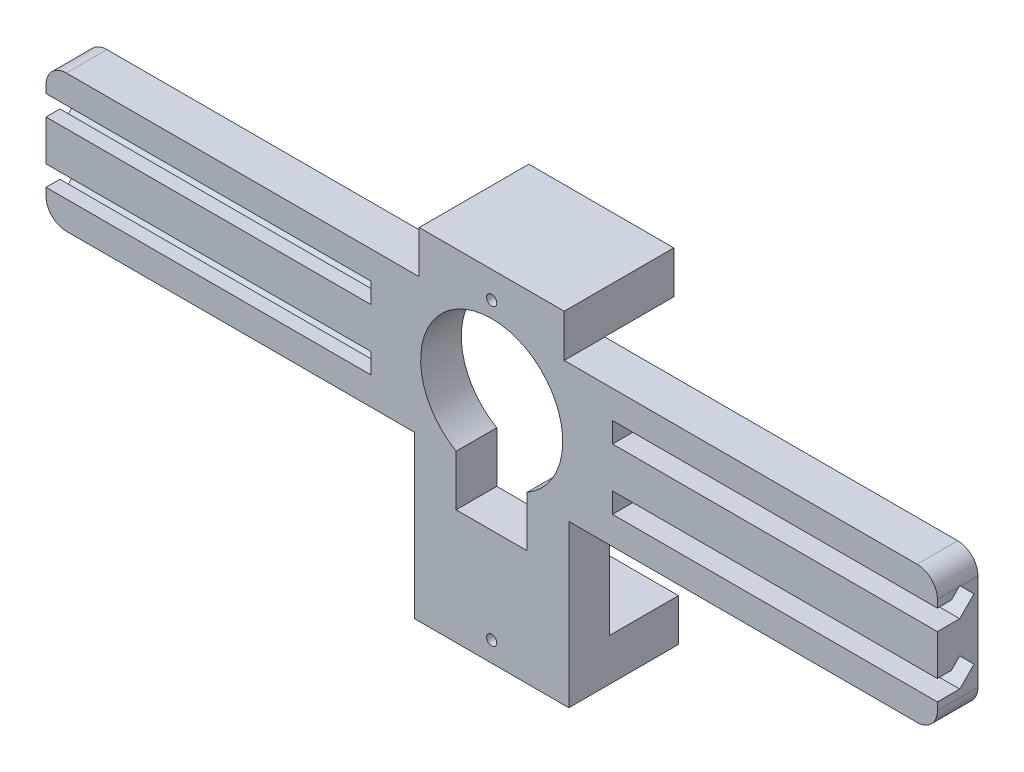
from build123d import *
from build123d.topology import SkipClean

# Parameters (mm, degrees)
SKETCH_1_R              = 0.5
EXTRUDE_1_DEPTH         = 4
CUT_EXTRUDE_1_DEPTH     = 32
FILLET_2_R              = 2
EXTRUDE_START           = 6.8
SKETCH_3_W              = 14.282856858
SKETCH_3_H              = 4.17
SKETCH_3_R              = 0.5
SKETCH_3_W_2            = 15.198684154
EXTRUDE_2_DEPTH         = 6.8
SALIENTE_EXTRUIR1_START = -32
SALIENTE_EXTRUIR1_DEPTH = 32
CORTAR_EXTRUIR1_DEPTH   = 32


with BuildPart() as part:
    # 草图1 → 凸台-拉伸1 (new body)
    with BuildSketch(Plane.XY):
        Polygon((7.141428429, 7), (43.9, 7), (43.9, -6.5), (7.599342077, -6.5), (7.599342077, -22.4), (-7.599342077, -22.4), (-7.599342077, -6.5), (-43.9, -6.5), (-43.9, 7), (-7.141428429, 7), (-7.141428429, 11.2), (7.141428429, 11.2), align=None)
        with Locations((0, 8.575)):
            Circle(SKETCH_1_R, mode=Mode.SUBTRACT)
        with Locations((0, -20.42)):
            Circle(SKETCH_1_R, mode=Mode.SUBTRACT)
        with BuildLine():
            Line((-3.5, -11.062177826), (3.5, -11.062177826))
            Line((3.5, -11.062177826), (3.5, -6.062177826))
            ThreePointArc((3.5, -6.062177826), (0, 7), (-3.5, -6.062177826))
            Line((-3.5, -6.062177826), (-3.5, -11.062177826))
        make_face(mode=Mode.SUBTRACT)
    extrude(amount=EXTRUDE_1_DEPTH)

    # 草图2 → 切除-拉伸1 (cut)
    with BuildSketch(Plane(origin=(43.9, 0, 0), x_dir=(0, 0, -1), z_dir=(1, 0, 0))):
        Polygon((-4, 2.25), (-1.8, 2.25), (-0.385786438, 3.664213562), (-1.8, 5.078427125), (-2.628427125, 4.25), (-4, 4.25), align=None)
        Polygon((-1.8, -3.75), (-0.385786438, -2.335786438), (-1.8, -0.921572875), (-2.628427125, -1.75), (-4, -1.75), (-4, -3.75), align=None)
    cut_extrude_1 = extrude(amount=-CUT_EXTRUDE_1_DEPTH, mode=Mode.SUBTRACT)

    # 镜向1: 切除-拉伸1 across plane
    add(cut_extrude_1.mirror(Plane(origin=(0, 0, 0), x_dir=(0, 0, 1), z_dir=(1, 0, 0))), mode=Mode.SUBTRACT)

    # 圆角2
    # the kernel refuses this fillet: 2 mm, written as the material it takes off along each edge
    with BuildSketch(Plane(origin=(43.9, 7, -5), x_dir=(-1, 0, 0), z_dir=(0, 0, 1)), Plane(origin=(43.9, -6.5, -5), x_dir=(0, 1, 0), z_dir=(0, 0, 1)), Plane(origin=(-43.9, -6.5, -5), x_dir=(1, 0, 0), z_dir=(0, 0, 1)), Plane(origin=(-43.9, 7, -5), x_dir=(0, -1, 0), z_dir=(0, 0, 1))) as fillet_2_piece_1:
        with BuildLine():
            CenterArc((FILLET_2_R, FILLET_2_R), FILLET_2_R, 180, 90)
            Line((0, FILLET_2_R), (0, 0))
            Line((0, 0), (FILLET_2_R, 0))
        make_face()
    extrude(amount=14, mode=Mode.SUBTRACT)

    # 草图3 → 凸台-拉伸2 (add)
    # profile 1 of 2: a face of its own
    with BuildSketch(Plane(origin=(0, 0, 0), x_dir=(-1, 0, 0), z_dir=(0, 0, -1)).offset(EXTRUDE_START)):
        with Locations((0, 9.115)):
            Rectangle(SKETCH_3_W, SKETCH_3_H)
        with Locations((0, 8.575)):
            Circle(SKETCH_3_R, mode=Mode.SUBTRACT)
    # profile 2 of 2: a face of its own
    with BuildSketch(Plane(origin=(0, 0, 0), x_dir=(-1, 0, 0), z_dir=(0, 0, -1)).offset(EXTRUDE_START)):
        with Locations((0, -20.315)):
            Rectangle(SKETCH_3_W_2, SKETCH_3_H)
        with Locations((0, -20.42)):
            Circle(SKETCH_3_R, mode=Mode.SUBTRACT)
    extrude(amount=-EXTRUDE_2_DEPTH)

    # Croquis1 → Saliente-Extruir1 (add)
    with SkipClean():  # the faces are left unmerged after this step: merging them gives an invalid solid
        with BuildSketch(Plane.ZY.offset(43.9).offset(SALIENTE_EXTRUIR1_START)):
            Polygon((1.721572875, 5), (0, 5), (0, -4.5), (4, -4.5), (4, -3.75), (1.8, -3.75), (0.385786438, -2.335786438), (1.8, -0.921572875), (2.628427125, -1.75), (4, -1.75), (4, 2.25), (1.8, 2.25), (0.385786438, 3.664213562), align=None)
            Polygon((1.8, -3.75), (4, -3.75), (4, -1.75), (2.628427125, -1.75), (1.8, -0.921572875), (0.385786438, -2.335786438), align=None)
            Polygon((4, 5), (1.721572875, 5), (0.385786438, 3.664213562), (1.8, 2.25), (4, 2.25), align=None)
        extrude(amount=SALIENTE_EXTRUIR1_DEPTH)
    add(part.part.scale(1), mode=Mode.REPLACE)  # the faces are merged on a copy

    # Croquis4 → Cortar-Extruir1 (cut)
    with BuildSketch(Plane.ZY.offset(43.9)):
        Polygon((0.385786438, -3.164213562), (1.8, -4.578427125), (2.628427125, -3.75), (4, -3.75), (4, -1.75), (1.8, -1.75), align=None)
        Polygon((2.628427125, 2.25), (4, 2.25), (4, 4.25), (1.8, 4.25), (0.385786438, 2.835786438), (1.8, 1.421572875), align=None)
    extrude(amount=-CORTAR_EXTRUIR1_DEPTH, mode=Mode.SUBTRACT)


solid = part.part
